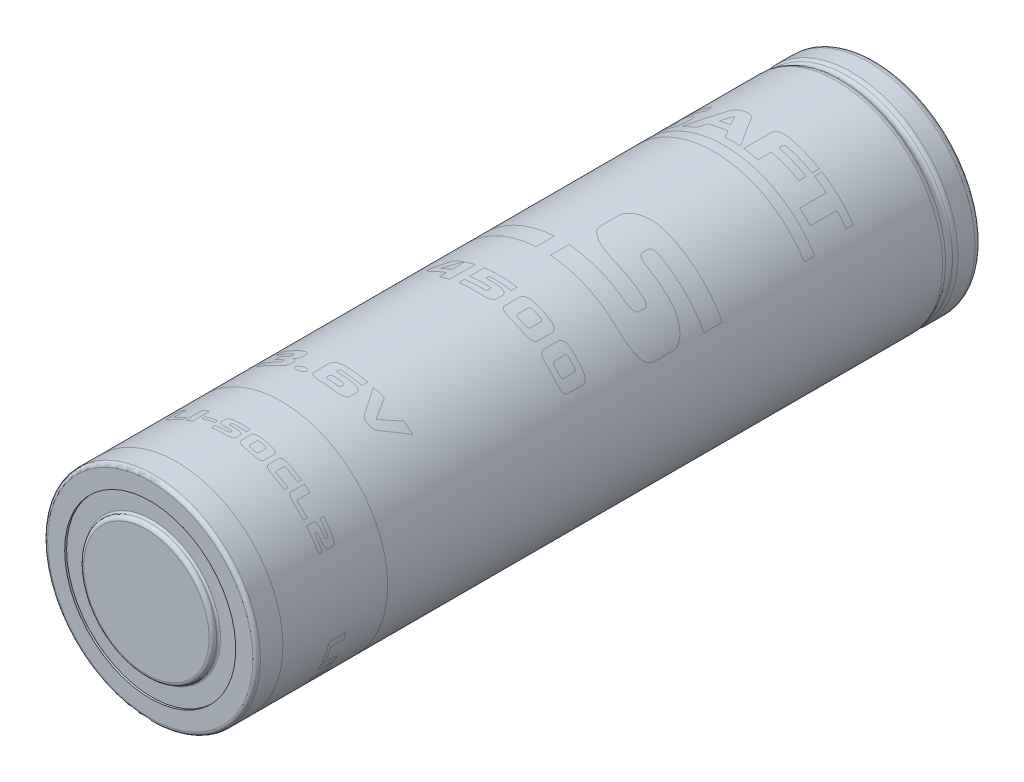
from build123d import *


with BuildPart() as part:
    # Sketch1 → Revolve1 (revolve)
    with BuildSketch(Plane(origin=(0, 0, 0), x_dir=(0, 0, -1), z_dir=(1, 0, 0))):
        with BuildLine():
            Line((0.381, 4.572), (0.381, 5.715))
            Line((0.381, 5.715), (0.254, 5.715))
            Line((0.254, 5.715), (0.254, 6.858))
            ThreePointArc((0.254, 6.858), (0.328394878, 7.037605122), (0.508, 7.112))
            Line((0.508, 7.112), (46.101, 7.112))
            ThreePointArc((46.101, 7.112), (46.246972726, 7.090575753), (46.380633028, 7.028110092))
            ThreePointArc((46.380633028, 7.028110092), (46.609, 6.9596), (46.837366972, 7.028110092))
            ThreePointArc((46.837366972, 7.028110092), (46.971027274, 7.090575753), (47.117, 7.112))
            Line((47.117, 7.112), (48.26, 7.112))
            ThreePointArc((48.26, 7.112), (48.619210245, 6.963210245), (48.768, 6.604))
            Line((48.768, 6.604), (48.768, 4.826))
            Line((48.768, 4.826), (48.641, 4.826))
            Line((48.641, 4.826), (48.641, 2.413))
            Line((48.641, 2.413), (49.911, 2.413))
            ThreePointArc((49.911, 2.413), (50.180407684, 2.301407684), (50.292, 2.032))
            Line((50.292, 2.032), (50.292, 0))
            Line((50.292, 0), (9.387370484, 0))
            Line((9.387370484, 0), (3.724236213, 0))
            Line((3.724236213, 0), (0, 0))
            Line((0, 0), (0, 4.191))
            ThreePointArc((0, 4.191), (0.074394878, 4.370605122), (0.254, 4.445))
            ThreePointArc((0.254, 4.445), (0.343802561, 4.482197439), (0.381, 4.572))
        make_face()
    revolve(axis=Axis((0, 0, -50.292), (0, 0, 1)))


solid = part.part
